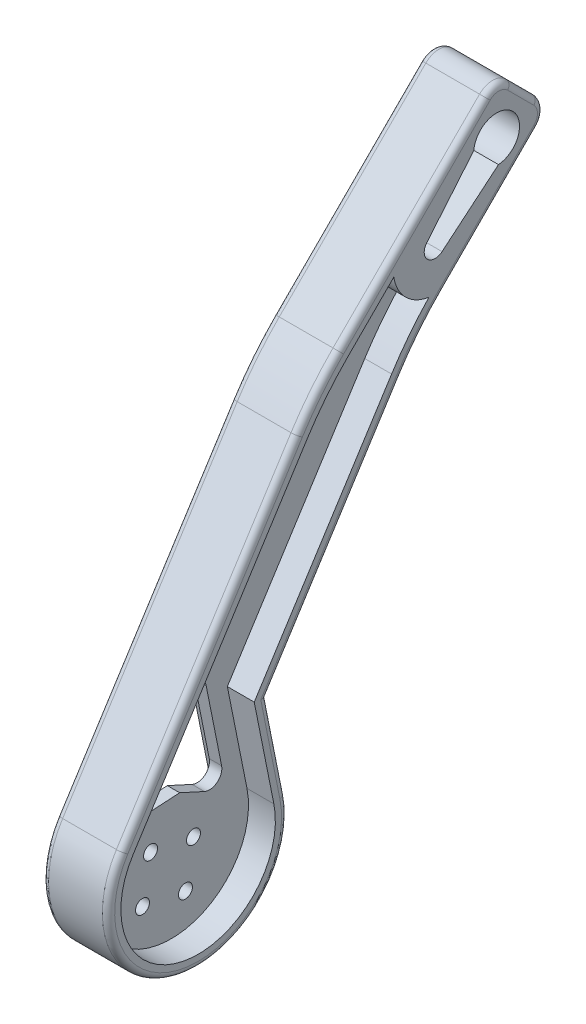
from build123d import *

# Parameters (mm, degrees)
BOSS_EXTRUDE1_DEPTH   = 5.35
FILLET1_R             = 2
FILLET2_R             = 50
FILLET3_R             = 3
CUT_EXTRUDE1_DEPTH    = 120.515289654
CUT_EXTRUDE2_DEPTH    = 8.7
SHELL3_START          = 1
SHELL3_DEPTH          = 4.35
CUT_EXTRUDE3_DEPTH    = 4.35
FILLET6_R             = 1
F_2_CLEARANCE_HOLE1_D = 2.2606


# Read off the part's stored shape, not the designer's step: Shell3
with BuildPart() as part:
    # Sketch1 → Boss-Extrude1 (new, symmetric)
    with BuildSketch(Plane(origin=(0, 0, 0), x_dir=(0, 0, -1), z_dir=(1, 0, 0))):
        with BuildLine():
            Line((0, 0), (8.485281374, -8.485281374))
            Line((8.485281374, -8.485281374), (-12.727922061, -29.69848481))
            Line((-12.727922061, -29.69848481), (-37.462892244, -68.482260413))
            Line((-37.462892244, -68.482260413), (-34.443484132, -83.547139186))
            ThreePointArc((-34.443484132, -83.547139186), (-51.327394218, -100.649341384), (-60.88605591, -78.599767092))
            Line((-60.88605591, -78.599767092), (-29.69848481, -29.69848481))
            Line((-29.69848481, -29.69848481), (0, 0))
        make_face()
        Polygon((-55.587939854, -79.591037977), (-43.982885085, -61.39462065), (-39.741600188, -82.555868301), (-47.296955003, -79.107566033), align=None, mode=Mode.SUBTRACT)
    extrude(amount=BOSS_EXTRUDE1_DEPTH, both=True)

    # Fillet1
    fillet1_edges = [part.edges().sort_by_distance(p)[0] for p in [
        (0, -82.555868301, 39.741600188),
        (0, -61.39462065, 43.982885085),
        (0, -79.591037977, 55.587939854),
    ]]
    fillet(fillet1_edges, radius=FILLET1_R)

    # Fillet2
    fillet2_edges = [part.edges().sort_by_distance(p)[0] for p in [
        (0, -29.69848481, 12.727922061),
        (0, -29.69848481, 29.69848481),
    ]]
    fillet(fillet2_edges, radius=FILLET2_R)

    # Fillet3
    fillet3_edges = [part.edges().sort_by_distance(p)[0] for p in [
        (0, 0, 0),
        (0, -8.485281374, -8.485281374),
    ]]
    fillet(fillet3_edges, radius=FILLET3_R)

    # Sketch2 → Cut-Extrude1 (cut, through all)
    with BuildSketch(Plane(origin=(5.35, 0, 0), x_dir=(0, 0, -1), z_dir=(1, 0, 0))):
        with BuildLine():
            ThreePointArc((3.346446609, -8.838834765), (-0.207139317, -5.141732803), (-4.041965779, -8.546235975))
            ThreePointArc((-4.041965779, -8.546235975), (-2.969848481, -11.455129855), (-0.060954601, -12.527247153))
            ThreePointArc((-0.060954601, -12.527247153), (2.364222862, -11.349550248), (3.346446609, -8.838834765))
        make_face()
    extrude(amount=-CUT_EXTRUDE1_DEPTH, mode=Mode.SUBTRACT)

    # Sketch2<3> → Cut-Extrude2 (cut)
    with BuildSketch(Plane(origin=(5.35, 0, 0), x_dir=(0, 0, -1), z_dir=(1, 0, 0))):
        with BuildLine():
            ThreePointArc((-0.060954601, -12.527247153), (-2.969848481, -11.455129855), (-4.041965779, -8.546235975))
            Line((-4.041965779, -8.546235975), (-11.667353013, -17.673561649))
            ThreePointArc((-11.667353013, -17.673561649), (-11.561195872, -20.046477247), (-9.188280275, -20.152634388))
            Line((-9.188280275, -20.152634388), (-0.060954601, -12.527247153))
        make_face()
    extrude(amount=-CUT_EXTRUDE2_DEPTH, mode=Mode.SUBTRACT)

    # Shell3 outline → Shell3 (cut)
    with BuildSketch(Plane.YZ.offset(SHELL3_START)):
        with BuildLine():
            ThreePointArc((-25.487766305, 11.315546566), (-23.591345049, 15.08737762), (-19.826956258, 16.998529133))
            Line((-19.826956258, 16.998529133), (-27.249508266, 24.421081141))
            ThreePointArc((-27.249508266, 24.421081141), (-31.137049165, 27.906978673), (-35.380230094, 30.949982361))
            Line((-35.380230094, 30.949982361), (-79.675200579, 59.199804797))
            ThreePointArc((-79.675200579, 59.199804797), (-98.683454279, 50.9595792), (-83.940176521, 36.404484299))
            Line((-83.940176521, 36.404484299), (-68.085752059, 39.582138666))
            Line((-68.085752059, 39.582138666), (-33.229363122, 17.351921839))
            ThreePointArc((-33.229363122, 17.351921839), (-29.215798711, 14.516830312), (-25.487766305, 11.315546566))
        make_face()
        with BuildLine():
            ThreePointArc((-78.71831814, 40.510748766), (-80.678728763, 41.229436179), (-80.930811667, 43.302157969))
            Line((-80.930811667, 43.302157969), (-79.107566033, 47.296955003))
            Line((-79.107566033, 47.296955003), (-79.363195628, 51.680706992))
            ThreePointArc((-79.363195628, 51.680706992), (-78.378789867, 53.5220833), (-76.291153896, 53.48338626))
            Line((-76.291153896, 53.48338626), (-65.582774367, 46.653946778))
            ThreePointArc((-65.582774367, 46.653946778), (-64.692320748, 44.599880647), (-66.265170518, 43.006695498))
            Line((-66.265170518, 43.006695498), (-78.71831814, 40.510748766))
        make_face(mode=Mode.SUBTRACT)
    extrude(amount=SHELL3_DEPTH, mode=Mode.SUBTRACT)

    # Sketch3 → Cut-Extrude3 (cut)
    with BuildSketch(Plane.ZY.offset(5.35)):
        with BuildLine():
            Line((16.998529133, -19.826956258), (24.421081141, -27.249508266))
            ThreePointArc((24.421081141, -27.249508266), (27.906978673, -31.137049165), (30.949982361, -35.380230094))
            Line((30.949982361, -35.380230094), (59.199804797, -79.675200579))
            ThreePointArc((59.199804797, -79.675200579), (50.9595792, -98.683454279), (36.404484299, -83.940176521))
            Line((36.404484299, -83.940176521), (39.582138666, -68.085752059))
            Line((39.582138666, -68.085752059), (17.351921839, -33.229363122))
            Line((17.351921839, -33.229363122), (11.315546566, -25.487766305))
            ThreePointArc((11.315546566, -25.487766305), (15.08737762, -23.591345049), (16.998529133, -19.826956258))
        make_face()
    extrude(amount=-CUT_EXTRUDE3_DEPTH, mode=Mode.SUBTRACT)

    # Fillet6
    fillet6_edges = [part.edges().sort_by_distance(p)[0] for p in [
        (5.35, -100.649341384, 51.327394218),
        (5.35, -76.0146998, 35.953188188),
        (5.35, -51.393528511, 26.564281485),
        (-5.35, -18.220948211, 1.250385462),
        (5.35, -18.220948211, 1.250385462),
        (-5.35, -56.45228185, 46.761144692),
        (5.35, -56.45228185, 46.761144692),
        (-5.35, -29.884816473, 29.466437966),
        (5.35, -29.884816473, 29.466437966),
        (-5.35, -29.884816473, 12.495875217),
        (5.35, -29.884816473, 12.495875217),
        (-5.35, -4.242640687, -4.242640687),
        (5.35, -4.242640687, -4.242640687),
        (-5.35, -13.978307524, 13.978307524),
        (-5.35, -1.242640687, 0),
        (-5.35, -8.485281374, -7.242640687),
        (5.35, -13.978307524, 13.978307524),
        (5.35, -1.242640687, 0),
        (5.35, -8.485281374, -7.242640687),
        (-5.35, -51.393528511, 26.564281485),
        (-5.35, -76.0146998, 35.953188188),
        (-5.35, -100.649341384, 51.327394218),
    ]]
    fillet(fillet6_edges, radius=FILLET6_R)

    # #2 Clearance Hole1 (through all)
    with Locations(Plane(origin=(1, -85.089251529, 52.013004842), x_dir=(0, 0, 1), z_dir=(1, 0, 0))):
        with Locations((0, 0), (-6.950460518, 1.300422466), (1.300422466, 6.950460517), (-5.650038052, 8.250882984)):
            Hole(F_2_CLEARANCE_HOLE1_D / 2)


solid = part.part
